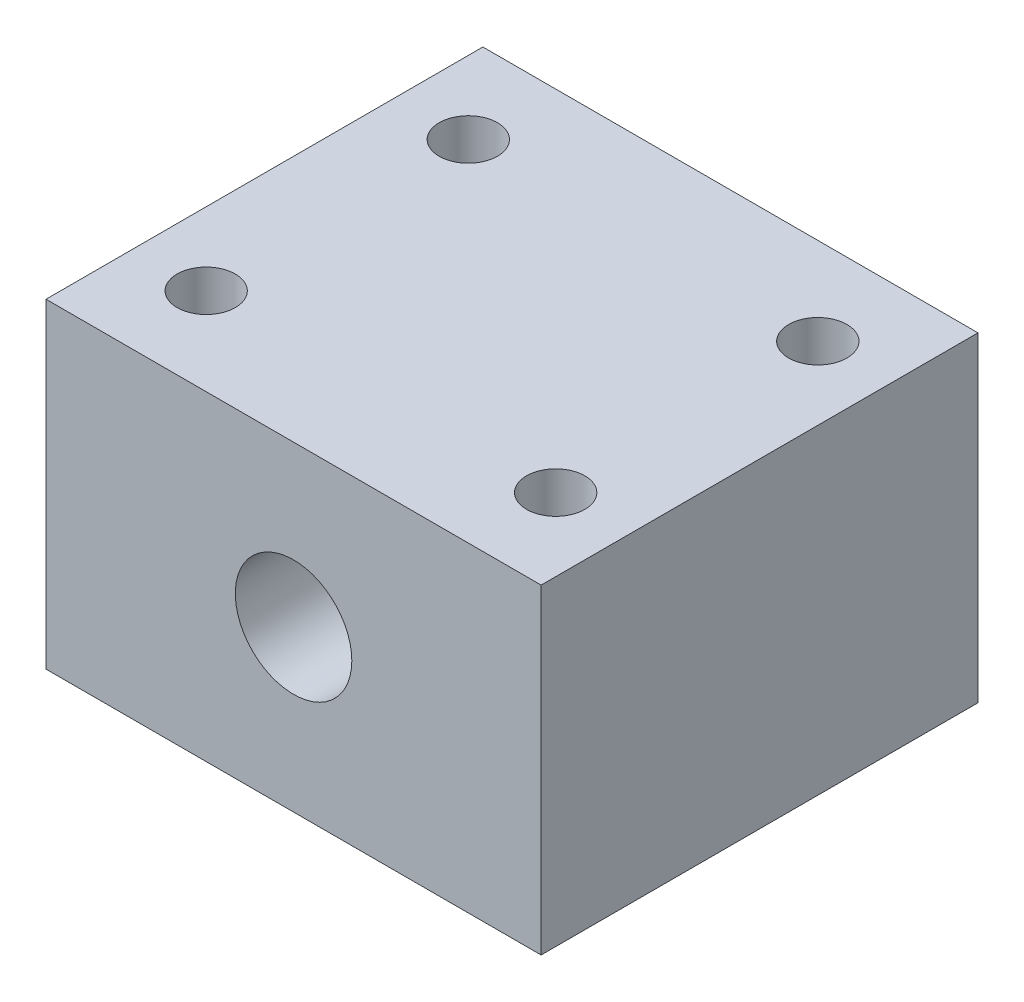
from build123d import *

# Parameters (mm, degrees)
SKETCH1_W           = 34
SKETCH1_H           = 22
SKETCH1_R           = 4
BOSS_EXTRUDE1_DEPTH = 30
SKETCH2_R           = 2
CUT_EXTRUDE1_DEPTH  = 51.398412673


with BuildPart() as part:
    # Sketch1 → Boss-Extrude1 (new body)
    with BuildSketch(Plane.XY):
        with Locations((17, 11)):
            Rectangle(SKETCH1_W, SKETCH1_H)
        with Locations((17, 11)):
            Circle(SKETCH1_R, mode=Mode.SUBTRACT)
    extrude(amount=BOSS_EXTRUDE1_DEPTH)

    # Sketch2 → Cut-Extrude1 (cut, through all)
    with BuildSketch(Plane(origin=(0, 22, 0), x_dir=(1, 0, 0), z_dir=(0, 1, 0))):
        with Locations((5, -24)):
            Circle(SKETCH2_R)
        with Locations((5, -6)):
            Circle(SKETCH2_R)
        with Locations((29, -6)):
            Circle(SKETCH2_R)
        with Locations((29, -24)):
            Circle(SKETCH2_R)
    extrude(amount=-CUT_EXTRUDE1_DEPTH, mode=Mode.SUBTRACT)


solid = part.part
